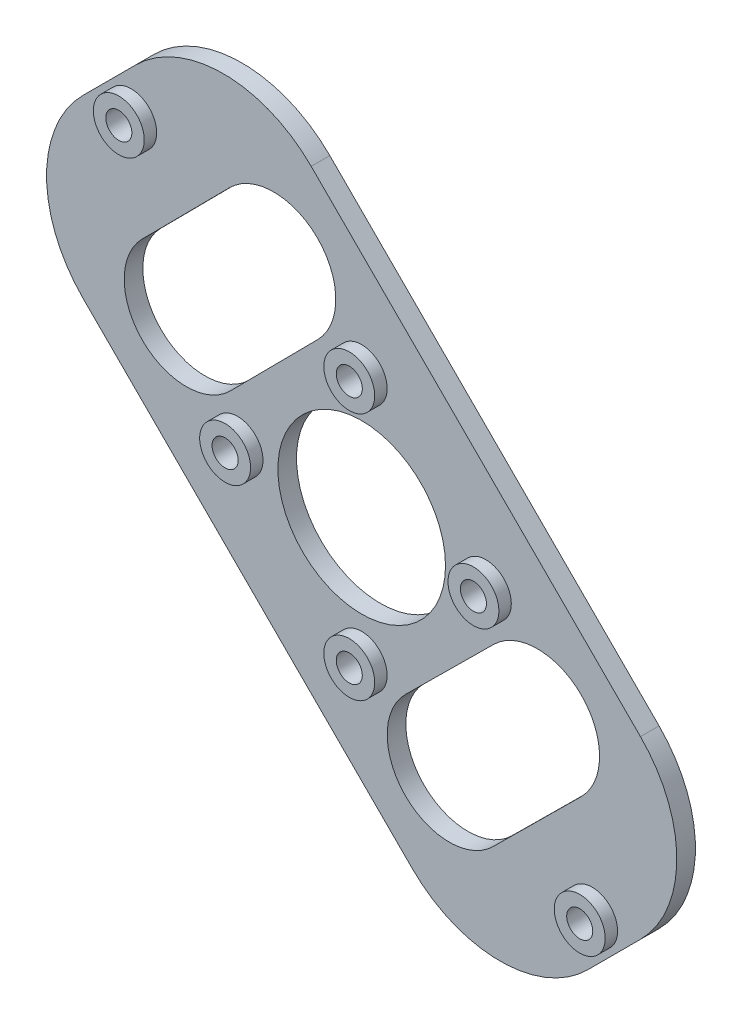
from build123d import *

# Parameters (mm, degrees)
ESQUISSE1_R             = 2.1
ESQUISSE1_R_2           = 13.5
BOSS_EXTRU_1_DEPTH      = 3
ESQUISSE2_R             = 2.1
ENL_V_MAT_EXTRU_1_DEPTH = 3
ESQUISSE3_R             = 4.1
ESQUISSE3_R_2           = 2.1
BOSS_EXTRU_2_DEPTH      = 2
ENL_V_MAT_EXTRU_2_DEPTH = 3
CONG_1_R                = 20


with BuildPart() as part:
    # Esquisse1 → Boss.-Extru.1 (new body)
    with BuildSketch(Plane.XY):
        Polygon((22.273863607, -59.043416229), (-59.043416229, 22.273863607), (-22.273863607, 59.043416229), (59.043416229, -22.273863607), align=None)
        with Locations((0, 20)):
            Circle(ESQUISSE1_R, mode=Mode.SUBTRACT)
        Circle(ESQUISSE1_R_2, mode=Mode.SUBTRACT)
        with Locations((20, 0)):
            Circle(ESQUISSE1_R, mode=Mode.SUBTRACT)
        with Locations((0, -20)):
            Circle(ESQUISSE1_R, mode=Mode.SUBTRACT)
        with Locations((-20, 0)):
            Circle(ESQUISSE1_R, mode=Mode.SUBTRACT)
    extrude(amount=BOSS_EXTRU_1_DEPTH)

    # Esquisse2 → Enlèv. mat.-Extru.1 (cut)
    with BuildSketch(Plane.XY.offset(3)):
        with Locations((-37.123106012, 37.123106012)):
            Circle(ESQUISSE2_R)
        with Locations((37.123106012, -37.123106012)):
            Circle(ESQUISSE2_R)
    extrude(amount=-ENL_V_MAT_EXTRU_1_DEPTH, mode=Mode.SUBTRACT)

    # Esquisse3 → Boss.-Extru.2 (add)
    # profile 1 of 6: a face of its own
    with BuildSketch(Plane.XY.offset(3)):
        with Locations((37.123106012, -37.123106012)):
            Circle(ESQUISSE3_R)
        with Locations((37.123106012, -37.123106012)):
            Circle(ESQUISSE3_R_2, mode=Mode.SUBTRACT)
    # profile 2 of 6: a face of its own
    with BuildSketch(Plane.XY.offset(3)):
        with Locations((20, 0)):
            Circle(ESQUISSE3_R)
        with Locations((20, 0)):
            Circle(ESQUISSE3_R_2, mode=Mode.SUBTRACT)
    # profile 3 of 6: a face of its own
    with BuildSketch(Plane.XY.offset(3)):
        with Locations((0, -20)):
            Circle(ESQUISSE3_R)
        with Locations((0, -20)):
            Circle(ESQUISSE3_R_2, mode=Mode.SUBTRACT)
    # profile 4 of 6: a face of its own
    with BuildSketch(Plane.XY.offset(3)):
        with Locations((-20, 0)):
            Circle(ESQUISSE3_R)
        with Locations((-20, 0)):
            Circle(ESQUISSE3_R_2, mode=Mode.SUBTRACT)
    # profile 5 of 6: a face of its own
    with BuildSketch(Plane.XY.offset(3)):
        with Locations((-37.123106012, 37.123106012)):
            Circle(ESQUISSE3_R)
        with Locations((-37.123106012, 37.123106012)):
            Circle(ESQUISSE3_R_2, mode=Mode.SUBTRACT)
    # profile 6 of 6: a face of its own
    with BuildSketch(Plane.XY.offset(3)):
        with Locations((0, 20)):
            Circle(ESQUISSE3_R)
        with Locations((0, 20)):
            Circle(ESQUISSE3_R_2, mode=Mode.SUBTRACT)
    extrude(amount=BOSS_EXTRU_2_DEPTH)

    # Esquisse4 → Enlèv. mat.-Extru.2 (cut)
    with BuildSketch(Plane.XY.offset(3)):
        with BuildLine():
            Line((-35.355194284, 21.149212527), (-21.277194344, 35.355194284))
            ThreePointArc((-21.277194344, 35.355194284), (-7.135203496, 35.419185193), (-7.071212587, 21.277194344))
            Line((-7.071212587, 21.277194344), (-21.149212527, 7.071212587))
            ThreePointArc((-21.149212527, 7.071212587), (-35.291203375, 7.007221678), (-35.355194284, 21.149212527))
        make_face()
        with BuildLine():
            Line((21.149212527, -35.355194284), (35.355194284, -21.277194344))
            ThreePointArc((35.355194284, -21.277194344), (35.419185193, -7.135203496), (21.277194344, -7.071212587))
            Line((21.277194344, -7.071212587), (7.071212587, -21.149212527))
            ThreePointArc((7.071212587, -21.149212527), (7.007221678, -35.291203375), (21.149212527, -35.355194284))
        make_face()
    extrude(amount=-ENL_V_MAT_EXTRU_2_DEPTH, mode=Mode.SUBTRACT)

    # Congé1
    cong_1_edges = [part.edges().sort_by_distance(p)[0] for p in [
        (22.273863607, -59.043416229, 1.5),
        (59.043416229, -22.273863607, 1.5),
        (-22.273863607, 59.043416229, 1.5),
        (-59.043416229, 22.273863607, 1.5),
    ]]
    fillet(cong_1_edges, radius=CONG_1_R)


solid = part.part
